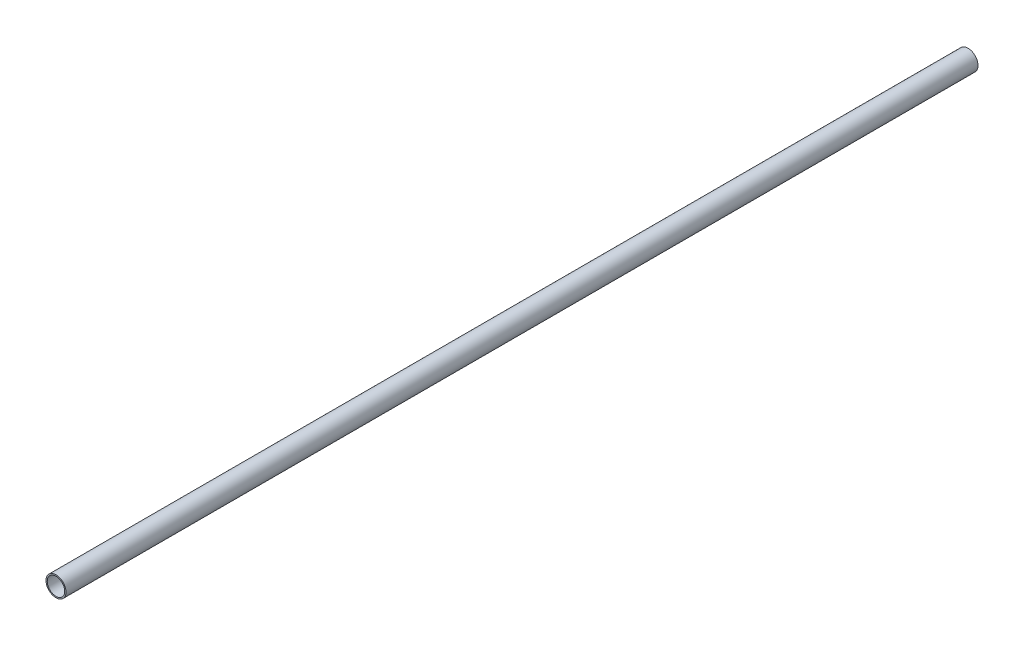
from build123d import *

# Parameters (mm, degrees)
SKETCH_1_R      = 8
SKETCH_1_R_2    = 7
EXTRUDE_1_DEPTH = 365


with BuildPart() as part:
    # Эскиз1 → Бобышка-Вытянуть1 (new, symmetric)
    with BuildSketch(Plane.XY):
        Circle(SKETCH_1_R)
        Circle(SKETCH_1_R_2, mode=Mode.SUBTRACT)
    extrude(amount=EXTRUDE_1_DEPTH, both=True)


solid = part.part
